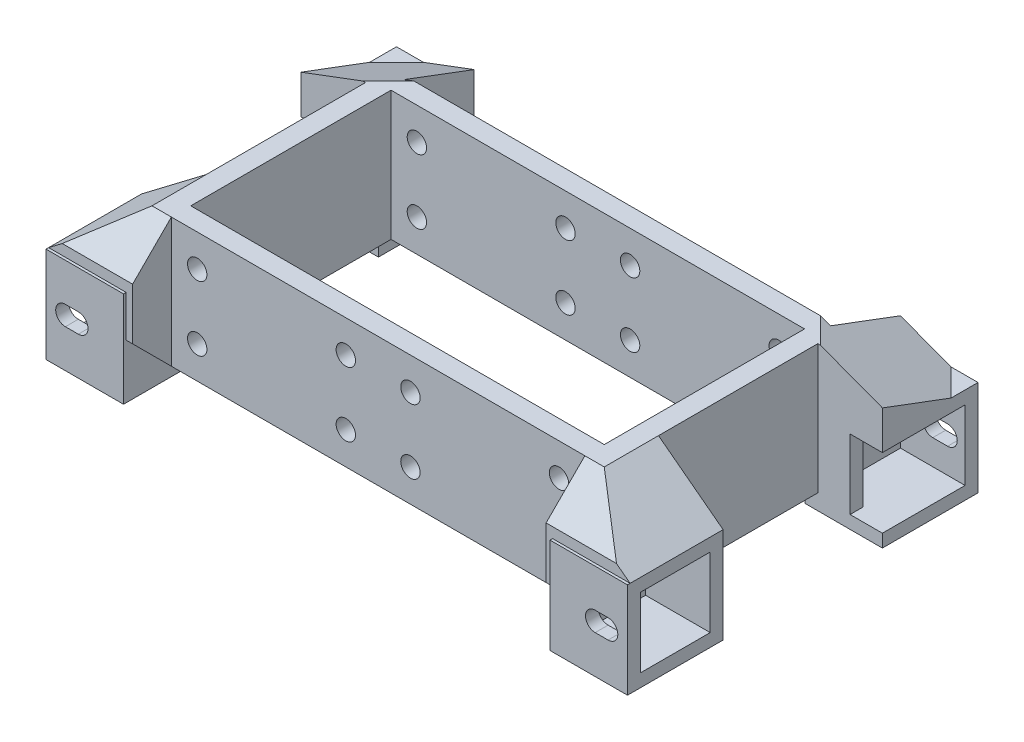
from build123d import *

# Parameters (mm, degrees)
SKETCH1_W            = 25
SKETCH1_H            = 20
BOSS_EXTRUDE1_DEPTH  = 3
SKETCH2_W            = 3
SKETCH2_H            = 20
BOSS_EXTRUDE2_DEPTH  = 40
SKETCH6_W            = 45
SKETCH6_H            = 20
BOSS_EXTRUDE3_DEPTH  = 3
SKETCH9_W            = 3
SKETCH9_H            = 20
BOSS_EXTRUDE4_DEPTH  = 40
CHAMFER1_SIZE        = 6
SKETCH17_W           = 14.8
SKETCH17_H           = 14.8
SKETCH17_W_2         = 10.8
SKETCH17_H_2         = 10.8
BOSS_EXTRUDE7_DEPTH  = 10
SKETCH18_W           = 14.8
SKETCH18_H           = 14.8
BOSS_EXTRUDE8_DEPTH  = 2
SKETCH21_W           = 14.8
SKETCH21_H           = 14.8
BOSS_EXTRUDE11_DEPTH = 2
BOSS_EXTRUDE12_REACH = 89.482
BOSS_EXTRUDE13_DEPTH = 7.6
CHAMFER4_SIZE        = 17
CHAMFER4_SIZE_2      = 9.039060338
CUT_EXTRUDE8_DEPTH   = 13
SKETCH27_W           = 2
SKETCH27_H           = 10.8
CUT_EXTRUDE10_DEPTH  = 3
CUT_EXTRUDE12_DEPTH  = 10
CUT_EXTRUDE13_START  = -10
CUT_EXTRUDE13_DEPTH  = 10
SKETCH40_W           = 2
SKETCH40_H           = 10.8
CUT_EXTRUDE16_DEPTH  = 2
SKETCH41_W           = 2
SKETCH41_H           = 10.8
CUT_EXTRUDE17_DEPTH  = 2
SKETCH51_W           = 3
SKETCH51_H           = 20
BOSS_EXTRUDE14_DEPTH = 64
SKETCH50_R           = 1.5
CUT_EXTRUDE22_DEPTH  = 82.203258526


# Read off the part's stored shape, not the designer's step: Mirror3
with BuildPart() as part:
    # Sketch1 → Boss-Extrude1 (new body)
    with BuildSketch(Plane.XY):
        Rectangle(SKETCH1_W, SKETCH1_H)
    extrude(amount=BOSS_EXTRUDE1_DEPTH)

    # Sketch2 → Boss-Extrude2 (add)
    with BuildSketch(Plane.XY.offset(3)):
        with Locations((-11, 0)):
            Rectangle(SKETCH2_W, SKETCH2_H)
    extrude(amount=BOSS_EXTRUDE2_DEPTH)

    # Sketch6 → Boss-Extrude3 (add)
    with BuildSketch(Plane(origin=(0, 0, 0), x_dir=(-1, 0, 0), z_dir=(0, 0, -1))):
        with Locations((-35, 0)):
            Rectangle(SKETCH6_W, SKETCH6_H)
    extrude(amount=-BOSS_EXTRUDE3_DEPTH)

    # Sketch9 → Boss-Extrude4 (add)
    with BuildSketch(Plane.XY.offset(3)):
        with Locations((56, 0)):
            Rectangle(SKETCH9_W, SKETCH9_H)
    extrude(amount=BOSS_EXTRUDE4_DEPTH)

    # Chamfer1
    chamfer1_edges = [part.edges().sort_by_distance(p)[0] for p in [
        (-11, -10, 43),
        (-11, 10, 43),
        (56, -10, 43),
        (56, 10, 43),
    ]]
    chamfer(chamfer1_edges, length=CHAMFER1_SIZE)

    # Sketch17 → Boss-Extrude7 (add)
    # profile 1 of 2: a face of its own
    with BuildSketch(Plane(origin=(57.5, 0, 0), x_dir=(0, 0, -1), z_dir=(1, 0, 0))):
        with Locations((3.445401219, -5)):
            Rectangle(SKETCH17_W, SKETCH17_H)
        with Locations((3.445401219, -5)):
            Rectangle(SKETCH17_W_2, SKETCH17_H_2, mode=Mode.SUBTRACT)
    # profile 2 of 2: a face of its own
    with BuildSketch(Plane(origin=(57.5, 0, 0), x_dir=(0, 0, -1), z_dir=(1, 0, 0))):
        with Locations((-36.004598781, -5)):
            Rectangle(SKETCH17_W, SKETCH17_H)
        with Locations((-36.004598781, -5)):
            Rectangle(SKETCH17_W_2, SKETCH17_H_2, mode=Mode.SUBTRACT)
    extrude(amount=BOSS_EXTRUDE7_DEPTH)

    # Sketch18 → Boss-Extrude8 (add)
    with BuildSketch(Plane.ZY.offset(-57.5)):
        with Locations((-3.445401219, -5)):
            Rectangle(SKETCH18_W, SKETCH18_H)
    extrude(amount=BOSS_EXTRUDE8_DEPTH)

    # Sketch21 → Boss-Extrude11 (add)
    with BuildSketch(Plane.ZY.offset(-57.5)):
        with Locations((36.004598781, -5)):
            Rectangle(SKETCH21_W, SKETCH21_H)
    extrude(amount=BOSS_EXTRUDE11_DEPTH)

    # Boss-Extrude12: up to this face of the body (flat: up to its plane)
    boss_extrude12_end = Plane(part.part.faces().sort_by_distance((62.311518325, -5.194764398, 28.604598781))[0])
    # Sketch22 → Boss-Extrude12 (add, up to the picked face)
    with BuildSketch(Plane.XY.offset(43.404598781), mode=Mode.PRIVATE) as boss_extrude12_sk1:
        Polygon((57.5, 2.4), (57.5, 10), (67.5, 2.4), align=None)
    boss_extrude12_tool1 = split(extrude(boss_extrude12_sk1.sketch, amount=-BOSS_EXTRUDE12_REACH, mode=Mode.PRIVATE), bisect_by=boss_extrude12_end, keep=Keep.BOTH, mode=Mode.PRIVATE)
    add(boss_extrude12_tool1.solids().sort_by(Axis((60.833333, 4.933333, 43.404599), (0, 0, -1)))[0])

    # Sketch23 → Boss-Extrude13 (add)
    with BuildSketch(Plane(origin=(0, 2.4, 0), x_dir=(1, 0, 0), z_dir=(0, 1, 0))):
        Polygon((55.5, 0), (57.5, 0), (57.5, -3.954598781), (67.5, -3.954598781), (67.5, 10.492881323), (67.147480104, 10.845401219), (55.5, 10.845401219), align=None)
    extrude(amount=BOSS_EXTRUDE13_DEPTH)

    # Chamfer4
    # the kernel refuses this chamfer: 17, 9.039060338 mm, written as the material it adds along each edge
    # the kernel refuses this chamfer: 17, 9.039060338 mm, written as the material it takes off along each edge
    with BuildSketch(Plane(origin=(98.618530871, 10, 20.625649548), x_dir=(-0.7069904920950609, 0.018135274312576832, 0.706990492095043), z_dir=(-0.7071067811865386, 0, -0.7071067811865565))) as chamfer4_2_piece_1_section:
        Polygon((CHAMFER4_SIZE * 0.99983554239, -CHAMFER4_SIZE * 0.0181352743126), (-CHAMFER4_SIZE_2 * 0.0181352743131, -CHAMFER4_SIZE_2 * 0.999835542417), (0, 0), align=None)
    chamfer4_2_piece_1 = extrude(amount=88.515035216, mode=Mode.PRIVATE)
    chamfer4_2_piece_1 = split(chamfer4_2_piece_1, bisect_by=Plane(origin=(63.588119048, 2.4, 1.757393484), z_dir=(0, 1, 0)), keep=Keep.TOP, mode=Mode.PRIVATE)
    add(chamfer4_2_piece_1, mode=Mode.SUBTRACT)

    # Sketch24 → Cut-Extrude8 (cut)
    with BuildSketch(Plane.ZY.offset(-57.5)):
        Polygon((37, 10), (43.404598781, 10), (43.404598781, 2.4), (43, 2.4), (43, 4), align=None)
    extrude(amount=-CUT_EXTRUDE8_DEPTH, mode=Mode.SUBTRACT)

    # Mirror3
    split(bisect_by=Plane.ZY.offset(-22.5), keep=Keep.BOTTOM)

    # Mirror3 2: part across plane


with BuildPart() as part_1:
    add(part.part)
    add(part.part.mirror(Plane.ZY.offset(-22.5)))

    # Sketch27 → Cut-Extrude10 (cut)
    with BuildSketch(Plane.ZY.offset(22.5)):
        with Locations((2.954598781, -5)):
            Rectangle(SKETCH27_W, SKETCH27_H)
    cut_extrude10 = extrude(amount=-CUT_EXTRUDE10_DEPTH, mode=Mode.SUBTRACT)

    # Mirror4: Cut-Extrude10 across plane
    add(cut_extrude10.mirror(Plane.ZY.offset(-22.5)), mode=Mode.SUBTRACT)

    # Sketch32 → Cut-Extrude12 (cut)
    with BuildSketch(Plane(origin=(0, 0, -10.845401219), x_dir=(-1, 0, 0), z_dir=(0, 0, -1))):
        with BuildLine():
            Line((19.790168373, -6.5), (17.5, -6.5))
            ThreePointArc((17.5, -6.5), (16, -5), (17.5, -3.5))
            Line((17.5, -3.5), (19.790168373, -3.5))
            ThreePointArc((19.790168373, -3.5), (21.290168373, -5), (19.790168373, -6.5))
        make_face()
        with BuildLine():
            Line((-64.790168373, -6.5), (-62.5, -6.5))
            ThreePointArc((-62.5, -6.5), (-61, -5), (-62.5, -3.5))
            Line((-62.5, -3.5), (-64.790168373, -3.5))
            ThreePointArc((-64.790168373, -3.5), (-66.290168373, -5), (-64.790168373, -6.5))
        make_face()
    extrude(amount=-CUT_EXTRUDE12_DEPTH, mode=Mode.SUBTRACT)

    # Sketch33 → Cut-Extrude13 (cut)
    with BuildSketch(Plane.XY.offset(43.404598781).offset(CUT_EXTRUDE13_START)):
        with BuildLine():
            Line((62.5, -3.5), (64.5, -3.5))
            ThreePointArc((64.5, -3.5), (66, -5), (64.5, -6.5))
            Line((64.5, -6.5), (62.5, -6.5))
            ThreePointArc((62.5, -6.5), (61, -5), (62.5, -3.5))
        make_face()
        with BuildLine():
            Line((-17.5, -6.5), (-19.5, -6.5))
            ThreePointArc((-19.5, -6.5), (-21, -5), (-19.5, -3.5))
            Line((-19.5, -3.5), (-17.5, -3.5))
            ThreePointArc((-17.5, -3.5), (-16, -5), (-17.5, -6.5))
        make_face()
    extrude(amount=CUT_EXTRUDE13_DEPTH, mode=Mode.SUBTRACT)

    # Sketch40 → Cut-Extrude16 (cut)
    with BuildSketch(Plane(origin=(64.5, 0, 0), x_dir=(0, 0, -1), z_dir=(1, 0, 0))):
        with Locations((-2.954598781, -5)):
            Rectangle(SKETCH40_W, SKETCH40_H)
    extrude(amount=-CUT_EXTRUDE16_DEPTH, mode=Mode.SUBTRACT)

    # Sketch41 → Cut-Extrude17 (cut)
    with BuildSketch(Plane.ZY.offset(19.5)):
        with Locations((2.954598781, -5)):
            Rectangle(SKETCH41_W, SKETCH41_H)
    extrude(amount=-CUT_EXTRUDE17_DEPTH, mode=Mode.SUBTRACT)

    # Sketch51 → Boss-Extrude14 (add)
    with BuildSketch(Plane(origin=(-9.5, 0, 0), x_dir=(0, 0, -1), z_dir=(1, 0, 0))):
        with Locations((-35.5, 0)):
            Rectangle(SKETCH51_W, SKETCH51_H)
    extrude(amount=BOSS_EXTRUDE14_DEPTH)

    # Sketch50 → Cut-Extrude22 (cut, through all)
    with BuildSketch(Plane(origin=(0, 0, 0), x_dir=(-1, 0, 0), z_dir=(0, 0, -1))):
        with Locations(Location((5.5, 5, 0), (0, 0, 90))):
            Circle(SKETCH50_R)
        with Locations(Location((5.5, -5, 0), (0, 0, 90))):
            Circle(SKETCH50_R)
        with Locations(Location((-50.5, -5, 0), (0, 0, 90))):
            Circle(SKETCH50_R)
        with Locations(Location((-50.5, 5, 0), (0, 0, 90))):
            Circle(SKETCH50_R)
        with Locations(Location((-27.5, 5, 0), (0, 0, 90))):
            Circle(SKETCH50_R)
        with Locations(Location((-27.5, -5, 0), (0, 0, 90))):
            Circle(SKETCH50_R)
        with Locations(Location((-17.5, -5, 0), (0, 0, 90))):
            Circle(SKETCH50_R)
        with Locations(Location((-17.5, 5, 0), (0, 0, 90))):
            Circle(SKETCH50_R)
    extrude(amount=-CUT_EXTRUDE22_DEPTH, mode=Mode.SUBTRACT)


solid = part_1.part
